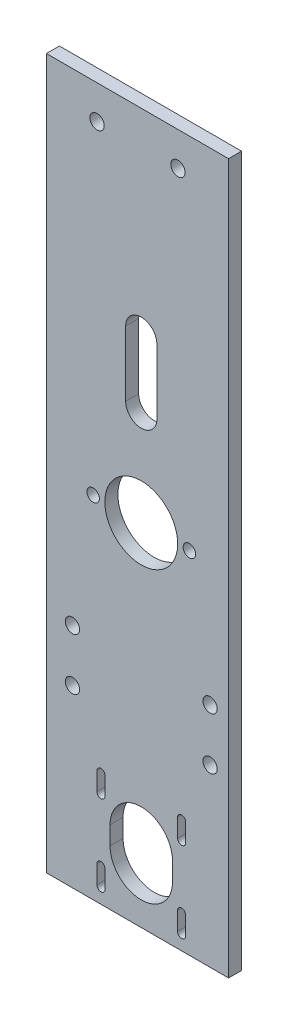
from build123d import *

# Parameters (mm, degrees)
SKETCH1_W           = 70
SKETCH1_H           = 154.713144252
SKETCH1_R           = 2.75
SKETCH1_R_2         = 2.4
SKETCH1_R_3         = 14
BOSS_EXTRUDE1_DEPTH = 5
SKETCH1_4_W         = 70
SKETCH1_4_H         = 118
SKETCH1_4_R         = 2.75
BOSS_EXTRUDE2_DEPTH = 5


with BuildPart() as part:
    # Sketch1 → Boss-Extrude1 (new body)
    with BuildSketch(Plane.XY):
        with Locations((-1.450472168, 0)):
            Rectangle(SKETCH1_W, SKETCH1_H)
        with Locations((-26.450472168, -10)):
            Circle(SKETCH1_R, mode=Mode.SUBTRACT)
        with BuildLine():
            ThreePointArc((-17.05, -64.643427874), (-15.5, -63.093427874), (-13.95, -64.643427874))
            Line((-13.95, -64.643427874), (-13.95, -71.643427874))
            ThreePointArc((-13.95, -71.643427874), (-15.5, -73.193427874), (-17.05, -71.643427874))
            Line((-17.05, -71.643427874), (-17.05, -64.643427874))
        make_face(mode=Mode.SUBTRACT)
        with BuildLine():
            ThreePointArc((-17.05, -33.643427874), (-15.5, -32.093427874), (-13.95, -33.643427874))
            Line((-13.95, -33.643427874), (-13.95, -40.643427874))
            ThreePointArc((-13.95, -40.643427874), (-15.5, -42.193427874), (-17.05, -40.643427874))
            Line((-17.05, -40.643427874), (-17.05, -33.643427874))
        make_face(mode=Mode.SUBTRACT)
        with Locations((-26.450472168, 10)):
            Circle(SKETCH1_R, mode=Mode.SUBTRACT)
        with Locations((-18.5, 57.356572126)):
            Circle(SKETCH1_R_2, mode=Mode.SUBTRACT)
        with BuildLine():
            ThreePointArc((12, -56.143427874), (0, -68.143427874), (-12, -56.143427874))
            Line((-12, -56.143427874), (-12, -49.143427874))
            ThreePointArc((-12, -49.143427874), (0, -37.143427874), (12, -49.143427874))
            Line((12, -49.143427874), (12, -56.143427874))
        make_face(mode=Mode.SUBTRACT)
        with BuildLine():
            ThreePointArc((13.95, -64.643427874), (15.5, -63.093427874), (17.05, -64.643427874))
            Line((17.05, -64.643427874), (17.05, -71.643427874))
            ThreePointArc((17.05, -71.643427874), (15.5, -73.193427874), (13.95, -71.643427874))
            Line((13.95, -71.643427874), (13.95, -64.643427874))
        make_face(mode=Mode.SUBTRACT)
        with BuildLine():
            ThreePointArc((13.95, -33.643427874), (15.5, -32.093427874), (17.05, -33.643427874))
            Line((17.05, -33.643427874), (17.05, -40.643427874))
            ThreePointArc((17.05, -40.643427874), (15.5, -42.193427874), (13.95, -40.643427874))
            Line((13.95, -40.643427874), (13.95, -33.643427874))
        make_face(mode=Mode.SUBTRACT)
        with Locations((26.450472168, -10)):
            Circle(SKETCH1_R, mode=Mode.SUBTRACT)
        with Locations((0, 57.356572126)):
            Circle(SKETCH1_R_3, mode=Mode.SUBTRACT)
        with Locations((26.450472168, 10)):
            Circle(SKETCH1_R, mode=Mode.SUBTRACT)
        with Locations((18.5, 57.356572126)):
            Circle(SKETCH1_R_2, mode=Mode.SUBTRACT)
    extrude(amount=BOSS_EXTRUDE1_DEPTH)

    # Sketch1<4> → Boss-Extrude2 (add)
    with BuildSketch(Plane.XY):
        with Locations((-1.450472168, 136.356572126)):
            Rectangle(SKETCH1_4_W, SKETCH1_4_H)
        with Locations((-16.991825546, 182.387739686)):
            Circle(SKETCH1_4_R, mode=Mode.SUBTRACT)
        with BuildLine():
            ThreePointArc((-6, 119.856572126), (0, 125.856572126), (6, 119.856572126))
            Line((6, 119.856572126), (6, 94.856572126))
            ThreePointArc((6, 94.856572126), (0, 88.856572126), (-6, 94.856572126))
            Line((-6, 94.856572126), (-6, 119.856572126))
        make_face(mode=Mode.SUBTRACT)
        with Locations((14.09088121, 182.387739686)):
            Circle(SKETCH1_4_R, mode=Mode.SUBTRACT)
    extrude(amount=BOSS_EXTRUDE2_DEPTH)


solid = part.part
